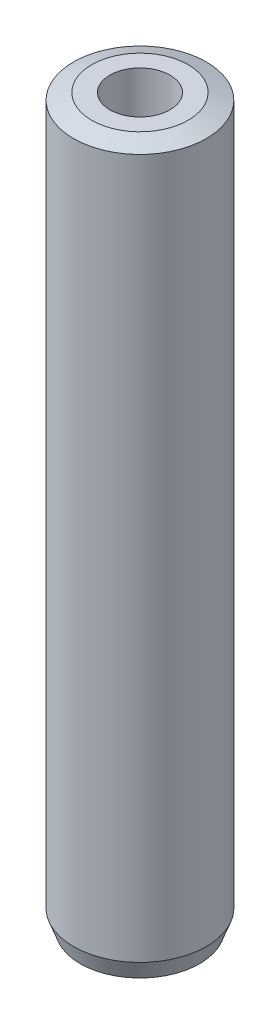
from build123d import *
from OCP.BRepFilletAPI import BRepFilletAPI_MakeChamfer

# Parameters (mm, degrees)
SKETCH1_R           = 55
BOSS_EXTRUDE1_DEPTH = 600
SKETCH2_R           = 24.907297934
CUT_EXTRUDE1_DEPTH  = 606.020660804
CHAMFER1_SIZE       = 5.565786462
CHAMFER1_SIZE2      = 15.101463509


with BuildPart() as part:
    # Sketch1 → Boss-Extrude1 (new body)
    with BuildSketch(Plane(origin=(0, 0, 0), x_dir=(1, 0, 0), z_dir=(0, 1, 0))):
        Circle(SKETCH1_R)
    extrude(amount=BOSS_EXTRUDE1_DEPTH)

    # Sketch2 → Cut-Extrude1 (cut, through all)
    with BuildSketch(Plane(origin=(0, 0, 0), x_dir=(1, 0, 0), z_dir=(0, 1, 0))):
        Circle(SKETCH2_R)
    extrude(amount=CUT_EXTRUDE1_DEPTH, mode=Mode.SUBTRACT)

    # Chamfer1: one chamfer whose edges measure the first distance from different faces: ONE call of the kernel's chamfer builder (chamfer() names one face for all edges)
    chamfer1_edges_1 = [part.edges().sort_by_distance(p)[0] for p in [
        (-55, 600, 0),
    ]]
    chamfer1_side_1 = [part.faces().sort_by_distance(p)[0] for p in [
        (-55, 300, 0),
    ]]
    chamfer1_edges_2 = [part.edges().sort_by_distance(p)[0] for p in [
        (-55, 0, 0),
    ]]
    chamfer1_side_2 = [part.faces().sort_by_distance(p)[0] for p in [
        (-53.444365081, 0, 0),
    ]]
    chamfer1 = BRepFilletAPI_MakeChamfer(part.part.solid().wrapped)
    for e in chamfer1_edges_1:
        chamfer1.Add(CHAMFER1_SIZE, CHAMFER1_SIZE2, e.wrapped, chamfer1_side_1[0].wrapped)  # the first distance lies on this face
    for e in chamfer1_edges_2:
        chamfer1.Add(CHAMFER1_SIZE, CHAMFER1_SIZE2, e.wrapped, chamfer1_side_2[0].wrapped)  # the first distance lies on this face
    add(Compound.cast(chamfer1.Shape()), mode=Mode.REPLACE)


solid = part.part
